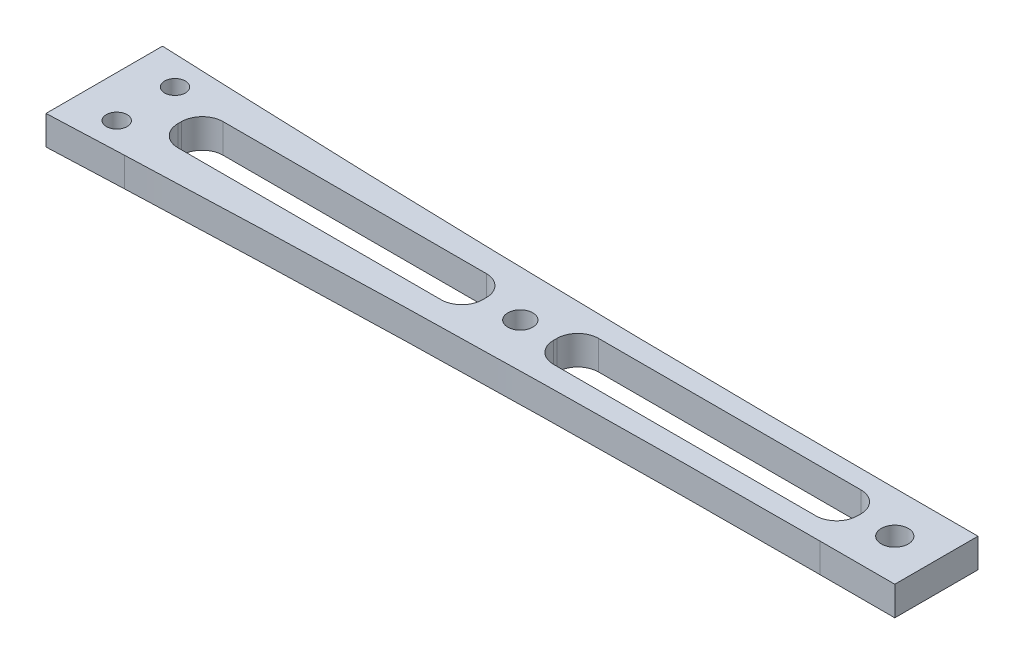
from build123d import *

# Parameters (mm, degrees)
SZKIC1_R                    = 3
SZKIC1_R_2                  = 3.25
SZKIC1_R_3                  = 2.5
DODANIE_WYCI_GNI_CIE1_DEPTH = 7
ZAOKR_GLENIE1_R             = 4100


with BuildPart() as part:
    # Szkic1 → Dodanie-wyciągnięcie1 (new body)
    with BuildSketch(Plane(origin=(0, 0, 0), x_dir=(1, 0, 0), z_dir=(0, 1, 0))):
        Polygon((200, 0), (200, 20), (100, 20), (0, 24), (0, -4), (100, 0), align=None)
        with Locations(Location((100, 10, 0), (0, 0, 270))):
            Circle(SZKIC1_R, mode=Mode.SUBTRACT)
        with Locations(Location((190, 10, 0), (0, 0, 270))):
            Circle(SZKIC1_R_2, mode=Mode.SUBTRACT)
        with Locations(Location((10, 17, 0), (0, 0, 270))):
            Circle(SZKIC1_R_3, mode=Mode.SUBTRACT)
        with Locations(Location((10, 3, 0), (0, 0, 270))):
            Circle(SZKIC1_R_3, mode=Mode.SUBTRACT)
        with BuildLine():
            Line((22.984822323, 15.57457628), (86.25939238, 15.57457628))
            ThreePointArc((86.25939238, 15.57457628), (89.794926286, 14.110110186), (91.25939238, 10.57457628))
            Line((91.25939238, 10.57457628), (91.25939238, 9.696719379))
            ThreePointArc((91.25939238, 9.696719379), (89.794926286, 6.161185473), (86.25939238, 4.696719379))
            Line((86.25939238, 4.696719379), (22.984822323, 4.696719379))
            ThreePointArc((22.984822323, 4.696719379), (19.449288417, 6.161185473), (17.984822323, 9.696719379))
            Line((17.984822323, 9.696719379), (17.984822323, 10.57457628))
            ThreePointArc((17.984822323, 10.57457628), (19.449288417, 14.110110186), (22.984822323, 15.57457628))
        make_face(mode=Mode.SUBTRACT)
        with BuildLine():
            Line((113.225148066, 15.57457628), (176.286209663, 15.57457628))
            ThreePointArc((176.286209663, 15.57457628), (179.821743569, 14.110110186), (181.286209663, 10.57457628))
            Line((181.286209663, 10.57457628), (181.286209663, 9.752776346))
            ThreePointArc((181.286209663, 9.752776346), (179.821743569, 6.21724244), (176.286209663, 4.752776346))
            Line((176.286209663, 4.752776346), (113.225148066, 4.752776346))
            ThreePointArc((113.225148066, 4.752776346), (109.68961416, 6.21724244), (108.225148066, 9.752776346))
            Line((108.225148066, 9.752776346), (108.225148066, 10.57457628))
            ThreePointArc((108.225148066, 10.57457628), (109.68961416, 14.110110186), (113.225148066, 15.57457628))
        make_face(mode=Mode.SUBTRACT)
    extrude(amount=DODANIE_WYCI_GNI_CIE1_DEPTH)

    # Zaokrąglenie1
    # the kernel refuses this fillet: 4100 mm, written as the material it adds along each edge
    with BuildSketch(Plane(origin=(100, 0, -20), x_dir=(1, 0, 0), z_dir=(0, 1, 0)), Plane(origin=(100, 0, 0), x_dir=(-0.9992009587217893, 0, 0.03996803834887583), z_dir=(0, 1, 0))) as zaokr_glenie1_piece_1:
        with BuildLine():
            CenterArc((ZAOKR_GLENIE1_R * 0.0199920063936, ZAOKR_GLENIE1_R), ZAOKR_GLENIE1_R, 267.709389957, 2.290610043)
            Line((-ZAOKR_GLENIE1_R * 0.0199760319553, ZAOKR_GLENIE1_R * 0.000799041278211), (0, 0))
            Line((0, 0), (ZAOKR_GLENIE1_R * 0.0199920063936, 0))
        make_face()
    extrude(amount=7)


solid = part.part
